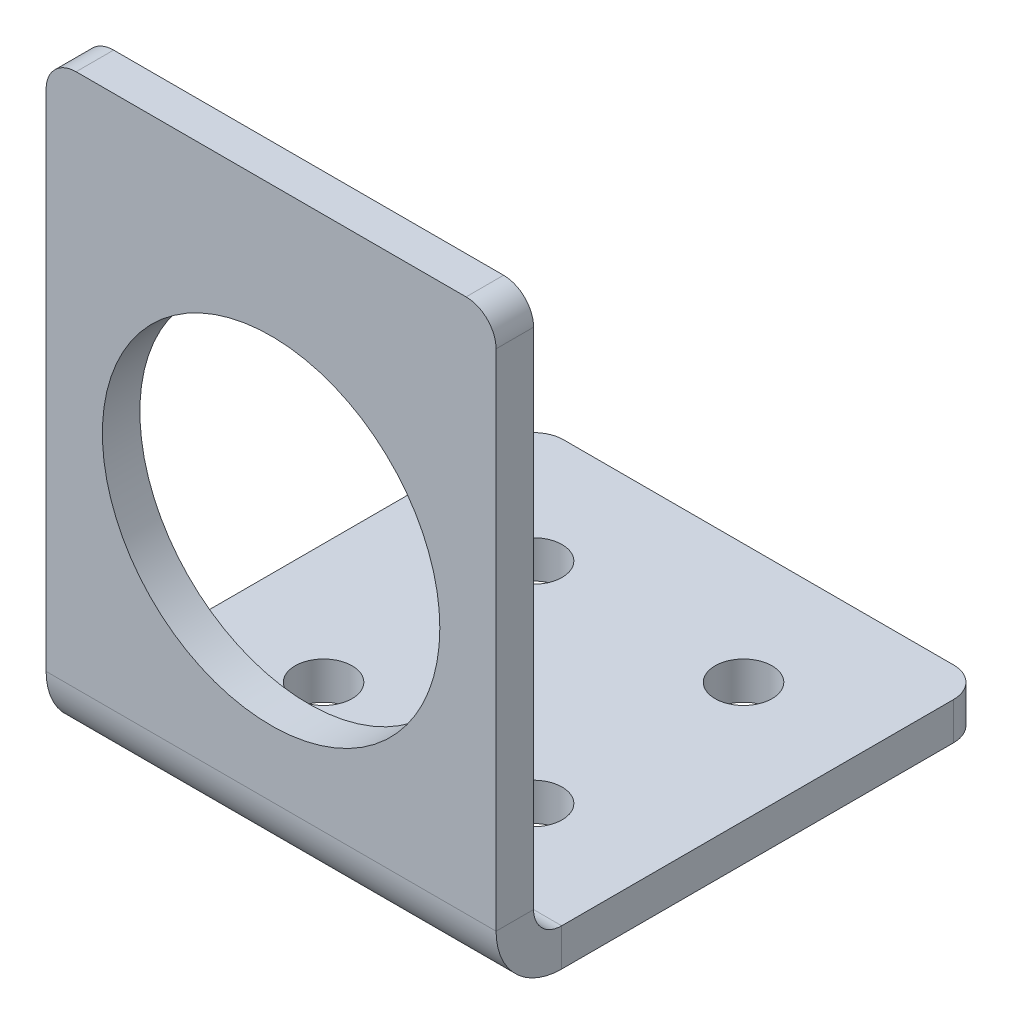
from build123d import *

# Parameters (mm, degrees)
SKETCH1_W              = 38.1
SKETCH1_H              = 50.8
SKETCH1_R              = 14.2875
BOSS_EXTRUDE1_DEPTH    = 3.175
SKETCH2_W              = 38.1
SKETCH2_H              = 3.175
BOSS_EXTRUDE2_DEPTH    = 38.1
SKETCH3_R              = 2.413
CUT_EXTRUDE1_DEPTH     = 64.895642457
CONVERT_SOLID1_START   = -19.05
CONVERT_SOLID1_DEPTH   = 38.1
CONVERT_SOLID1_2_DEPTH = 38.1
FILLET1_R              = 2.54


# Read off the part's stored shape, not the designer's step: Convert-Solid1
with BuildPart() as part:
    # Sketch1 → Boss-Extrude1 (new body)
    with BuildSketch(Plane.XY):
        Rectangle(SKETCH1_W, SKETCH1_H)
        Circle(SKETCH1_R, mode=Mode.SUBTRACT)
    extrude(amount=BOSS_EXTRUDE1_DEPTH)

    # Sketch2 → Boss-Extrude2 (add)
    with BuildSketch(Plane(origin=(0, 0, 0), x_dir=(-1, 0, 0), z_dir=(0, 0, -1))):
        with Locations((0, -23.8125)):
            Rectangle(SKETCH2_W, SKETCH2_H)
    extrude(amount=BOSS_EXTRUDE2_DEPTH)

    # Sketch3 → Cut-Extrude1 (cut, through all)
    with BuildSketch(Plane(origin=(0, -22.225, 0), x_dir=(1, 0, 0), z_dir=(0, 1, 0))):
        with Locations(Location((-8.89, 27.94, 0), (0, 0, 180))):
            Circle(SKETCH3_R)
        with Locations(Location((8.89, 27.94, 0), (0, 0, 180))):
            Circle(SKETCH3_R)
        with Locations(Location((-8.89, 10.16, 0), (0, 0, 180))):
            Circle(SKETCH3_R)
        with Locations(Location((8.89, 10.16, 0), (0, 0, 180))):
            Circle(SKETCH3_R)
    extrude(amount=-CUT_EXTRUDE1_DEPTH, mode=Mode.SUBTRACT)

    # Convert-Solid1 outline → Convert-Solid1 (cut)
    with BuildSketch(Plane.YZ.offset(CONVERT_SOLID1_START)):
        with BuildLine():
            ThreePointArc((-25.4, -2.380000066), (-23.77297815, 1.54797815), (-19.844999934, 3.175))
            Line((-19.844999934, 3.175), (-25.4, 3.175))
            Line((-25.4, 3.175), (-25.4, -2.380000066))
        make_face()
    extrude(amount=CONVERT_SOLID1_DEPTH, mode=Mode.SUBTRACT)

    # Convert-Solid1 2 outline → Convert-Solid1 2 (add)
    with BuildSketch(Plane.YZ.offset(CONVERT_SOLID1_START)):
        with BuildLine():
            ThreePointArc((-22.225, -2.380000066), (-21.52791412, -0.69708588), (-19.844999934, 0))
            Line((-19.844999934, 0), (-22.225, 0))
            Line((-22.225, 0), (-22.225, -2.380000066))
        make_face()
    extrude(amount=CONVERT_SOLID1_2_DEPTH)

    # Fillet1
    fillet1_edges = [part.edges().sort_by_distance(p)[0] for p in [
        (19.05, 25.4, 1.5875),
        (-19.05, 25.4, 1.5875),
        (-19.05, -23.8125, -38.1),
        (19.05, -23.8125, -38.1),
    ]]
    fillet(fillet1_edges, radius=FILLET1_R)


solid = part.part
